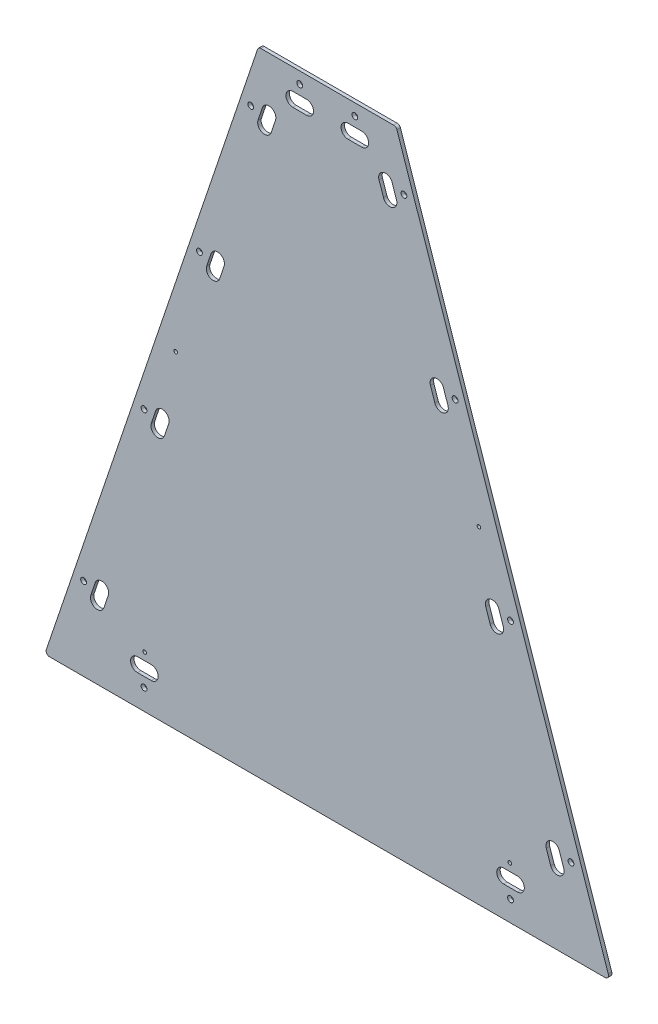
from build123d import *

# Parameters (mm, degrees)
SKETCH1_R                        = 5.3578125
BOSS_EXTRUDE1_DEPTH              = 6.35
FILLET1_R                        = 6.35
F_17_64_0_26563_DIAMETER_HOLE1_D = 6.747002


with BuildPart() as part:
    # Sketch1 → Boss-Extrude1 (new body)
    with BuildSketch(Plane.XY):
        Polygon((382.546632935, 292.971606529), (128.546632935, 292.971606529), (-265.153367065, -872.634633965), (776.246632935, -872.634633965), align=None)
        with BuildLine():
            ThreePointArc((-156.175349405, -744.456069305), (-172.271579978, -752.424215975), (-180.239726648, -736.327985402))
            Line((-180.239726648, -736.327985402), (-172.111642745, -712.26360816))
            ThreePointArc((-172.111642745, -712.26360816), (-156.015412172, -704.29546149), (-148.047265502, -720.391692063))
            Line((-148.047265502, -720.391692063), (-156.175349405, -744.456069305))
        make_face(mode=Mode.SUBTRACT)
        with Locations((-82.126785136, -834.534633965)):
            Circle(SKETCH1_R, mode=Mode.SUBTRACT)
        with BuildLine():
            ThreePointArc((-94.231734473, -816.754633965), (-106.931734473, -804.054633965), (-94.231734473, -791.354633965))
            Line((-94.231734473, -791.354633965), (-68.831734473, -791.354633965))
            ThreePointArc((-68.831734473, -791.354633965), (-56.131734473, -804.054633965), (-68.831734473, -816.754633965))
            Line((-68.831734473, -816.754633965), (-94.231734473, -816.754633965))
        make_face(mode=Mode.SUBTRACT)
        with Locations((-193.570796303, -720.234633965)):
            Circle(SKETCH1_R, mode=Mode.SUBTRACT)
        with Locations((-82.126785136, -390.288393471)):
            Circle(SKETCH1_R, mode=Mode.SUBTRACT)
        with BuildLine():
            ThreePointArc((-44.707720392, -414.439904738), (-60.803950965, -422.408051408), (-68.772097635, -406.311820835))
            Line((-68.772097635, -406.311820835), (-60.644013732, -382.247443592))
            ThreePointArc((-60.644013732, -382.247443592), (-44.54778316, -374.279296923), (-36.57963649, -390.375527495))
            Line((-36.57963649, -390.375527495), (-44.707720392, -414.439904738))
        make_face(mode=Mode.SUBTRACT)
        with Locations((593.220051006, -834.534633965)):
            Circle(SKETCH1_R, mode=Mode.SUBTRACT)
        with BuildLine():
            ThreePointArc((580.520051006, -816.754633965), (567.820051006, -804.054633965), (580.520051006, -791.354633965))
            Line((580.520051006, -791.354633965), (605.920051006, -791.354633965))
            ThreePointArc((605.920051006, -791.354633965), (618.620051006, -804.054633965), (605.920051006, -816.754633965))
            Line((605.920051006, -816.754633965), (580.520051006, -816.754633965))
        make_face(mode=Mode.SUBTRACT)
        with BuildLine():
            ThreePointArc((691.332992518, -736.327985402), (683.364845848, -752.424215975), (667.268615276, -744.456069305))
            Line((667.268615276, -744.456069305), (659.140531373, -720.391692063))
            ThreePointArc((659.140531373, -720.391692063), (667.108678043, -704.29546149), (683.204908616, -712.26360816))
            Line((683.204908616, -712.26360816), (691.332992518, -736.327985402))
        make_face(mode=Mode.SUBTRACT)
        with Locations((704.664062174, -720.234633965)):
            Circle(SKETCH1_R, mode=Mode.SUBTRACT)
        with BuildLine():
            ThreePointArc((579.865363506, -406.311820835), (571.897216836, -422.408051408), (555.800986263, -414.439904738))
            Line((555.800986263, -414.439904738), (547.67290236, -390.375527495))
            ThreePointArc((547.67290236, -390.375527495), (555.64104903, -374.279296923), (571.737279603, -382.247443592))
            Line((571.737279603, -382.247443592), (579.865363506, -406.311820835))
        make_face(mode=Mode.SUBTRACT)
        with Locations((593.220051006, -390.288393471)):
            Circle(SKETCH1_R, mode=Mode.SUBTRACT)
        with Locations((19.96580657, -88.028393471)):
            Circle(SKETCH1_R, mode=Mode.SUBTRACT)
        with BuildLine():
            ThreePointArc((57.266750557, -112.529618456), (41.170519984, -120.497765125), (33.202373314, -104.401534553))
            Line((33.202373314, -104.401534553), (41.330457217, -80.33715731))
            ThreePointArc((41.330457217, -80.33715731), (57.426687789, -72.36901064), (65.394834459, -88.465241213))
            Line((65.394834459, -88.465241213), (57.266750557, -112.529618456))
        make_face(mode=Mode.SUBTRACT)
        with Locations((114.659199441, 192.325199783)):
            Circle(SKETCH1_R, mode=Mode.SUBTRACT)
        with BuildLine():
            ThreePointArc((152.013630654, 167.98233153), (135.917400082, 160.01418486), (127.949253412, 176.110415433))
            Line((127.949253412, 176.110415433), (136.077337315, 200.174792676))
            ThreePointArc((136.077337315, 200.174792676), (152.173567887, 208.142939345), (160.141714557, 192.046708773))
            Line((160.141714557, 192.046708773), (152.013630654, 167.98233153))
        make_face(mode=Mode.SUBTRACT)
        with BuildLine():
            ThreePointArc((192.113515822, 228.547158802), (179.413515822, 241.247158802), (192.113515822, 253.947158802))
            Line((192.113515822, 253.947158802), (217.513515822, 253.947158802))
            ThreePointArc((217.513515822, 253.947158802), (230.213515822, 241.247158802), (217.513515822, 228.547158802))
            Line((217.513515822, 228.547158802), (192.113515822, 228.547158802))
        make_face(mode=Mode.SUBTRACT)
        with Locations((204.746632935, 271.727158802)):
            Circle(SKETCH1_R, mode=Mode.SUBTRACT)
        with BuildLine():
            ThreePointArc((477.890892557, -104.401534553), (469.922745887, -120.497765125), (453.826515314, -112.529618456))
            Line((453.826515314, -112.529618456), (445.698431411, -88.465241213))
            ThreePointArc((445.698431411, -88.465241213), (453.666578081, -72.36901064), (469.762808654, -80.33715731))
            Line((469.762808654, -80.33715731), (477.890892557, -104.401534553))
        make_face(mode=Mode.SUBTRACT)
        with Locations((491.127459301, -88.028393471)):
            Circle(SKETCH1_R, mode=Mode.SUBTRACT)
        with BuildLine():
            ThreePointArc((383.129387686, 176.153714205), (375.161241016, 160.057483633), (359.065010443, 168.025630302))
            Line((359.065010443, 168.025630302), (350.936926541, 192.090007545))
            ThreePointArc((350.936926541, 192.090007545), (358.905073211, 208.186238118), (375.001303783, 200.218091448))
            Line((375.001303783, 200.218091448), (383.129387686, 176.153714205))
        make_face(mode=Mode.SUBTRACT)
        with BuildLine():
            ThreePointArc((293.646632935, 228.547158802), (280.946632935, 241.247158802), (293.646632935, 253.947158802))
            Line((293.646632935, 253.947158802), (319.046632935, 253.947158802))
            ThreePointArc((319.046632935, 253.947158802), (331.746632935, 241.247158802), (319.046632935, 228.547158802))
            Line((319.046632935, 228.547158802), (293.646632935, 228.547158802))
        make_face(mode=Mode.SUBTRACT)
        with Locations((306.346632935, 271.727158802)):
            Circle(SKETCH1_R, mode=Mode.SUBTRACT)
        with Locations((396.756156044, 191.371606529)):
            Circle(SKETCH1_R, mode=Mode.SUBTRACT)
    extrude(amount=BOSS_EXTRUDE1_DEPTH)

    # Fillet1
    fillet1_edges = [part.edges().sort_by_distance(p)[0] for p in [
        (-265.153367065, -872.634633965, 3.175),
        (776.246632935, -872.634633965, 3.175),
        (382.546632935, 292.971606529, 3.175),
        (128.546632935, 292.971606529, 3.175),
    ]]
    fillet(fillet1_edges, radius=FILLET1_R)

    # 17/64 (0.26563) Diameter Hole1 (through all)
    with Locations(Plane.XY.offset(6.35)):
        with Locations((-23.853367065, -269.384633965), (534.946632935, -269.384633965), (592.096632935, -777.384633965), (-81.003367065, -777.384633965)):
            Hole(F_17_64_0_26563_DIAMETER_HOLE1_D / 2)


solid = part.part
